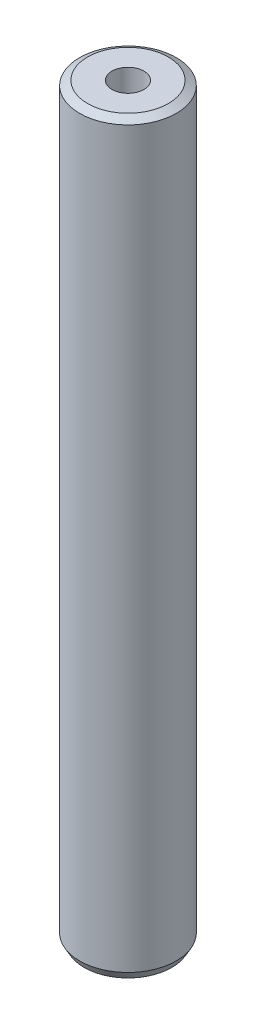
from build123d import *
from OCP.BRepFilletAPI import BRepFilletAPI_MakeChamfer

# Parameters (mm, degrees)
SKETCH1_R           = 35
BOSS_EXTRUDE1_DEPTH = 540.355789633
SKETCH2_R           = 11.555630883
CUT_EXTRUDE1_DEPTH  = 543.618078754
CHAMFER1_SIZE       = 3.256286484
CHAMFER1_SIZE2      = 5.770639156


with BuildPart() as part:
    # Sketch1 → Boss-Extrude1 (new body)
    with BuildSketch(Plane(origin=(0, 0, 0), x_dir=(1, 0, 0), z_dir=(0, 1, 0))):
        Circle(SKETCH1_R)
    extrude(amount=BOSS_EXTRUDE1_DEPTH)

    # Sketch2 → Cut-Extrude1 (cut, through all)
    with BuildSketch(Plane(origin=(0, 0, 0), x_dir=(1, 0, 0), z_dir=(0, 1, 0))):
        Circle(SKETCH2_R)
    extrude(amount=CUT_EXTRUDE1_DEPTH, mode=Mode.SUBTRACT)

    # Chamfer1: one chamfer whose edges measure the first distance from different faces: ONE call of the kernel's chamfer builder (chamfer() names one face for all edges)
    chamfer1_edges_1 = [part.edges().sort_by_distance(p)[0] for p in [
        (-35, 540.355789633, 0),
    ]]
    chamfer1_side_1 = [part.faces().sort_by_distance(p)[0] for p in [
        (-35, 270.177894817, 0),
    ]]
    chamfer1_edges_2 = [part.edges().sort_by_distance(p)[0] for p in [
        (-35, 0, 0),
    ]]
    chamfer1_side_2 = [part.faces().sort_by_distance(p)[0] for p in [
        (-34.010050506, 0, 0),
    ]]
    chamfer1 = BRepFilletAPI_MakeChamfer(part.part.solid().wrapped)
    for e in chamfer1_edges_1:
        chamfer1.Add(CHAMFER1_SIZE, CHAMFER1_SIZE2, e.wrapped, chamfer1_side_1[0].wrapped)  # the first distance lies on this face
    for e in chamfer1_edges_2:
        chamfer1.Add(CHAMFER1_SIZE, CHAMFER1_SIZE2, e.wrapped, chamfer1_side_2[0].wrapped)  # the first distance lies on this face
    add(Compound.cast(chamfer1.Shape()), mode=Mode.REPLACE)


solid = part.part
